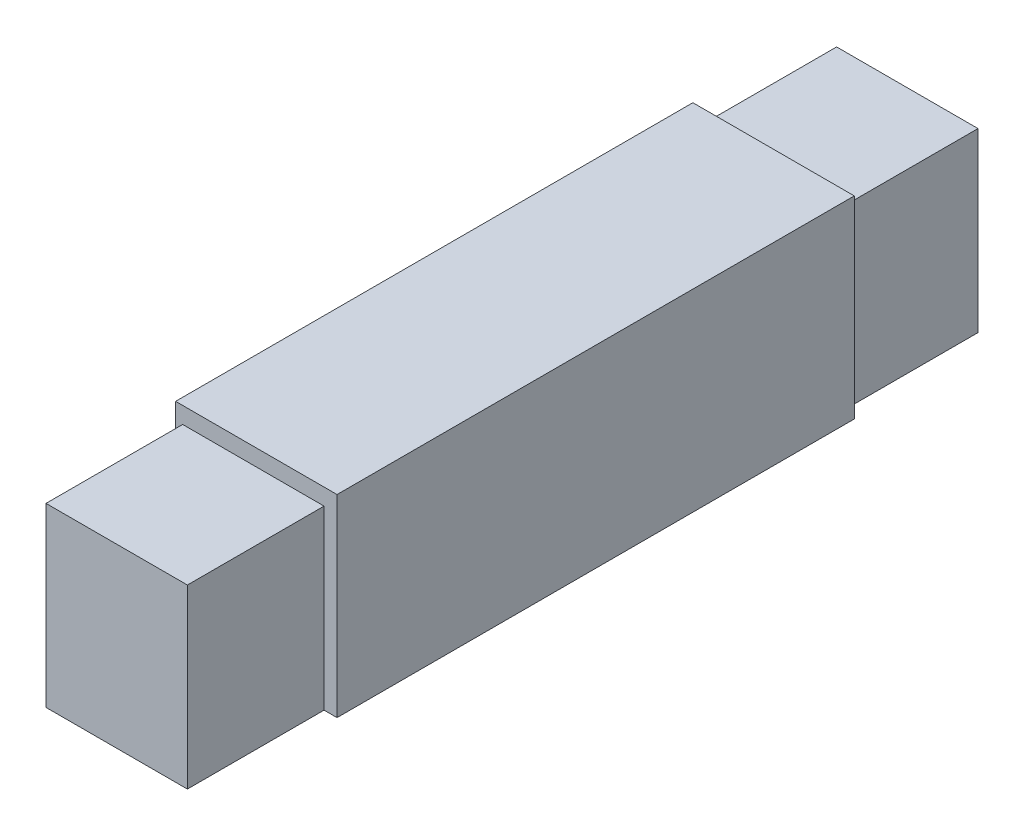
from build123d import *

# Parameters (mm, degrees)
SKETCH1_W           = 34.798
SKETCH1_H           = 41.656
BOSS_EXTRUDE2_DEPTH = 111.506
SKETCH2_W           = 30.48
SKETCH2_H           = 38.1
BOSS_EXTRUDE3_DEPTH = 29.464


with BuildPart() as part:
    # Sketch1 → Boss-Extrude2 (new body)
    with BuildSketch(Plane.XY):
        with Locations((17.399, 20.828)):
            Rectangle(SKETCH1_W, SKETCH1_H)
    extrude(amount=BOSS_EXTRUDE2_DEPTH)

    # Sketch2 → Boss-Extrude3 (add)
    with BuildSketch(Plane.XY.offset(111.506)):
        with Locations((16.764, 19.05)):
            Rectangle(SKETCH2_W, SKETCH2_H)
    boss_extrude3 = extrude(amount=BOSS_EXTRUDE3_DEPTH)

    # Mirror1: Boss-Extrude3 across plane
    add(boss_extrude3.mirror(Plane(origin=(0, 0, 55.753), x_dir=(1, 0, 0), z_dir=(0, 0, -1))))


solid = part.part
